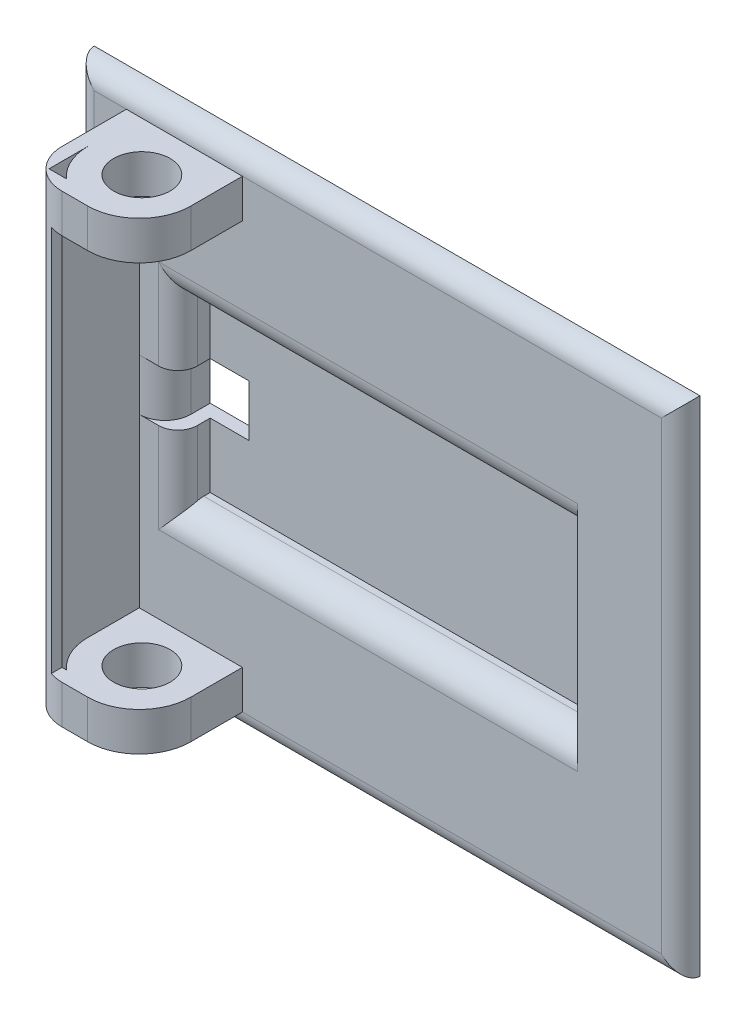
from build123d import *

# Parameters (mm, degrees)
ESQUISSE1_W             = 47
ESQUISSE1_H             = 39
BOSS_EXTRU_1_DEPTH      = 2.5
ESQUISSE2_W             = 8
ESQUISSE2_H             = 3
BOSS_EXTRU_2_DEPTH      = 8
ESQUISSE3_R             = 2.192012696
ENL_V_MAT_EXTRU_1_DEPTH = 62.036874101
CONG_1_R                = 4
ESQUISSE4_W             = 31
ESQUISSE4_H             = 14
ENL_V_MAT_EXTRU_2_DEPTH = 20
CONG_2_R                = 2
ESQUISSE8_W             = 1
ESQUISSE8_H             = 36
BOSS_EXTRU_5_DEPTH      = 8
ESQUISSE9_W             = 1
ESQUISSE9_H             = 36
BOSS_EXTRU_6_DEPTH      = 4
ESQUISSE10_W            = 7.449336574
ESQUISSE10_H            = 30
ENL_V_MAT_EXTRU_4_DEPTH = 8
CONG_4_R                = 3
ESQUISSE11_OUTSIDE_W    = 61.394
ESQUISSE11_OUTSIDE_H    = 53.394
ESQUISSE11_OUTSIDE_W_2  = 39
ESQUISSE11_OUTSIDE_H_2  = 25
ENL_V_MAT_EXTRU_5_DEPTH = 1
ESQUISSE12_W            = 39
ESQUISSE12_H            = 25
BOSS_EXTRU_7_DEPTH      = 1
ENL_V_MAT_EXTRU_6_REACH = 63.595
ESQUISSE13_W            = 4
ESQUISSE13_H            = 4
CONG_6_R                = 2
CONG_7_R                = 1.5
CONG_8_R                = 1.5


# Some blends are built 0.0001 mm under size
with BuildPart() as part:
    # Esquisse1 → Boss.-Extru.1 (new body)
    with BuildSketch(Plane.XY):
        with Locations((23.5, 19.5)):
            Rectangle(ESQUISSE1_W, ESQUISSE1_H)
    extrude(amount=BOSS_EXTRU_1_DEPTH)

    # Esquisse2 → Boss.-Extru.2 (add)
    with BuildSketch(Plane.XY.offset(2.5)):
        with Locations((9, 36)):
            Rectangle(ESQUISSE2_W, ESQUISSE2_H)
        with Locations((9, 3)):
            Rectangle(ESQUISSE2_W, ESQUISSE2_H)
    extrude(amount=BOSS_EXTRU_2_DEPTH)

    # Esquisse3 → Enlèv. mat.-Extru.1 (cut, through all)
    with BuildSketch(Plane.XZ.offset(-1.5)):
        with Locations(Location((9, 6.3, 0), (0, 0, 270))):
            Circle(ESQUISSE3_R)
    extrude(amount=-ENL_V_MAT_EXTRU_1_DEPTH, mode=Mode.SUBTRACT)

    # Congé1
    cong_1_edges = [part.edges().sort_by_distance(p)[0] for p in [
        (13, 3, 10.5),
        (5, 3, 10.5),
        (13, 36, 10.5),
        (5, 36, 10.5),
    ]]
    fillet(cong_1_edges, radius=CONG_1_R - 0.0001)  # a hair under: the kernel refuses the full size

    # Esquisse4 → Enlèv. mat.-Extru.2 (cut)
    with BuildSketch(Plane.XY.offset(2.5)):
        with Locations((23.5, 19.5)):
            Rectangle(ESQUISSE4_W, ESQUISSE4_H)
    extrude(amount=-ENL_V_MAT_EXTRU_2_DEPTH, mode=Mode.SUBTRACT)

    # Congé2
    cong_2_edges = [part.edges().sort_by_distance(p)[0] for p in [
        (23.5, 12.5, 2.5),
        (23.5, 26.5, 2.5),
    ]]
    fillet(cong_2_edges, radius=CONG_2_R)

    # Esquisse8 → Boss.-Extru.5 (add)
    with BuildSketch(Plane.XY.offset(2.5)):
        with Locations((4.5, 19.5)):
            Rectangle(ESQUISSE8_W, ESQUISSE8_H)
    extrude(amount=BOSS_EXTRU_5_DEPTH)

    # Esquisse9 → Boss.-Extru.6 (add)
    with BuildSketch(Plane(origin=(5, 0, 0), x_dir=(0, 0, -1), z_dir=(1, 0, 0))):
        with Locations((-10, 19.5)):
            Rectangle(ESQUISSE9_W, ESQUISSE9_H)
    extrude(amount=BOSS_EXTRU_6_DEPTH)

    # Esquisse10 → Enlèv. mat.-Extru.4 (cut)
    with BuildSketch(Plane.XY.offset(10.5)):
        with Locations((9.724668287, 19.5)):
            Rectangle(ESQUISSE10_W, ESQUISSE10_H)
    extrude(amount=-ENL_V_MAT_EXTRU_4_DEPTH, mode=Mode.SUBTRACT)

    # Congé4
    # the kernel refuses this fillet: 3 mm, written as the material it takes off along each edge
    with BuildSketch(Plane(origin=(4, -6, 10.5), x_dir=(1, 0, 0), z_dir=(0, 1, 0))) as cong_4_piece_1:
        with BuildLine():
            CenterArc((CONG_4_R, CONG_4_R), CONG_4_R, 180, 90)
            Line((0, CONG_4_R), (0, 0))
            Line((0, 0), (CONG_4_R, 0))
        make_face()
    extrude(amount=51, mode=Mode.SUBTRACT)

    # Esquisse11 outside → Enlèv. mat.-Extru.5 (cut)
    with BuildSketch(Plane(origin=(0, 0, 0), x_dir=(-1, 0, 0), z_dir=(0, 0, -1))):
        with Locations((-23.5, 19.5)):
            Rectangle(ESQUISSE11_OUTSIDE_W, ESQUISSE11_OUTSIDE_H)
        with Locations((-23.5, 19.5)):
            Rectangle(ESQUISSE11_OUTSIDE_W_2, ESQUISSE11_OUTSIDE_H_2, mode=Mode.SUBTRACT)
    extrude(amount=-ENL_V_MAT_EXTRU_5_DEPTH, mode=Mode.SUBTRACT)

    # Esquisse12 → Boss.-Extru.7 (add)
    with BuildSketch(Plane(origin=(0, 0, 0), x_dir=(-1, 0, 0), z_dir=(0, 0, -1))):
        with Locations((-23.5, 19.5)):
            Rectangle(ESQUISSE12_W, ESQUISSE12_H)
    extrude(amount=BOSS_EXTRU_7_DEPTH)

    # Esquisse13 → Enlèv. mat.-Extru.6 (cut, up to next)
    with BuildSketch(Plane.XY.offset(2.5), mode=Mode.PRIVATE) as enl_v_mat_extru_6_sk1:
        with Locations((9, 19.5)):
            Rectangle(ESQUISSE13_W, ESQUISSE13_H)
    enl_v_mat_extru_6_tool1 = extrude(enl_v_mat_extru_6_sk1.sketch, amount=-ENL_V_MAT_EXTRU_6_REACH, mode=Mode.PRIVATE) & part.part
    add(enl_v_mat_extru_6_tool1.solids().sort_by_distance((9, 19.5, 2.5))[0], mode=Mode.SUBTRACT)

    # Congé6
    cong_6_edges = [part.edges().sort_by_distance(p)[0] for p in [
        (7, 19.5, 2.5),
    ]]
    fillet(cong_6_edges, radius=CONG_6_R - 0.0001)  # a hair under: the kernel refuses the full size

    # Congé7
    cong_7_edges = [part.edges().sort_by_distance(p)[0] for p in [
        (8, 25, 2.5),
        (8, 14, 2.5),
        (0, 19.5, 2.5),
        (23.5, 0, 2.5),
        (47, 19.5, 2.5),
        (23.5, 39, 2.5),
    ]]
    fillet(cong_7_edges, radius=CONG_7_R - 0.0001)  # a hair under: the kernel refuses the full size

    # Congé8
    cong_8_edges = [part.edges().sort_by_distance(p)[0] for p in [
        (43, 19.5, -1),
        (23.5, 7, -1),
        (4, 19.5, -1),
        (23.5, 32, -1),
    ]]
    fillet(cong_8_edges, radius=CONG_8_R)


solid = part.part
